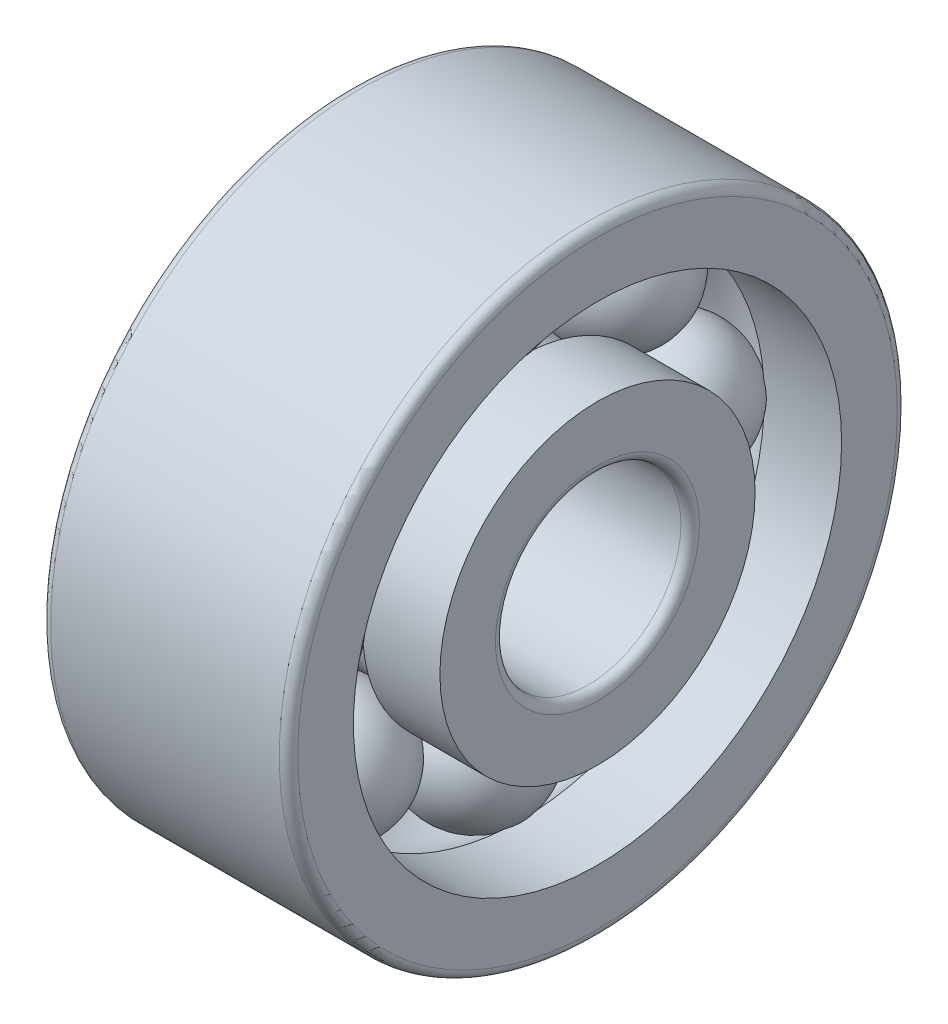
from build123d import *

# Parameters (mm, degrees)
CAGSPISKE_W         = 0.21
CAGSPISKE_H         = 0.35
CAGESPINE_ANGLE     = 0.001
BALLSDETAILED_COUNT = 8
BALLSDETAILED_ANGLE = 315


with BuildPart() as part:
    # CagSpiSke → CageSpine (revolve)
    with BuildSketch(Plane.XY):
        with Locations((0, 3.25)):
            Rectangle(CAGSPISKE_W, CAGSPISKE_H)
    revolve(axis=Axis((-20.6375, 0, 0), (-1, 0, 0)), revolution_arc=CAGESPINE_ANGLE)

    # BalDetSke → BallDetailed (revolve)
    with BuildSketch(Plane.XY):
        with BuildLine():
            Line((-1.05, 3.25), (1.05, 3.25))
            ThreePointArc((1.05, 3.25), (0, 2.2), (-1.05, 3.25))
        make_face()
    balldetailed = revolve(axis=Axis((-1.905, 3.25, 0), (1, 0, 0)))

    # InnRacSke → InnerRace (revolve)
    with BuildSketch(Plane.XY):
        with BuildLine():
            Line((-0.748748957, 2.55), (-2, 2.55))
            Line((-2, 2.55), (-2, 1.65))
            ThreePointArc((-2, 1.65), (-1.956066017, 1.543933983), (-1.85, 1.5))
            Line((-1.85, 1.5), (1.85, 1.5))
            ThreePointArc((1.85, 1.5), (1.956066017, 1.543933983), (2, 1.65))
            Line((2, 1.65), (2, 2.55))
            Line((2, 2.55), (0.748748957, 2.55))
            ThreePointArc((0.748748957, 2.55), (0, 2.225), (-0.748748957, 2.55))
        make_face()
    revolve(axis=Axis((-20.6375, 0, 0), (1, 0, 0)))

    # OutRacSke → OuterRace (revolve)
    with BuildSketch(Plane.XY):
        with BuildLine():
            Line((-0.748748957, 3.95), (-2, 3.95))
            Line((-2, 3.95), (-2, 4.85))
            ThreePointArc((-2, 4.85), (-1.956066017, 4.956066017), (-1.85, 5))
            Line((-1.85, 5), (1.85, 5))
            ThreePointArc((1.85, 5), (1.956066017, 4.956066017), (2, 4.85))
            Line((2, 4.85), (2, 3.95))
            Line((2, 3.95), (0.748748957, 3.95))
            ThreePointArc((0.748748957, 3.95), (0, 4.275), (-0.748748957, 3.95))
        make_face()
    revolve(axis=Axis((-20.6375, 0, 0), (1, 0, 0)))

    # BallsDetailed: BallDetailed ×8 about axis
    ballsdetailed_axis = Axis((-50, 0, 0), (1, 0, 0))
    for i in range(1, BALLSDETAILED_COUNT):
        add(balldetailed.rotate(ballsdetailed_axis, i * BALLSDETAILED_ANGLE / (BALLSDETAILED_COUNT - 1)))


solid = part.part
